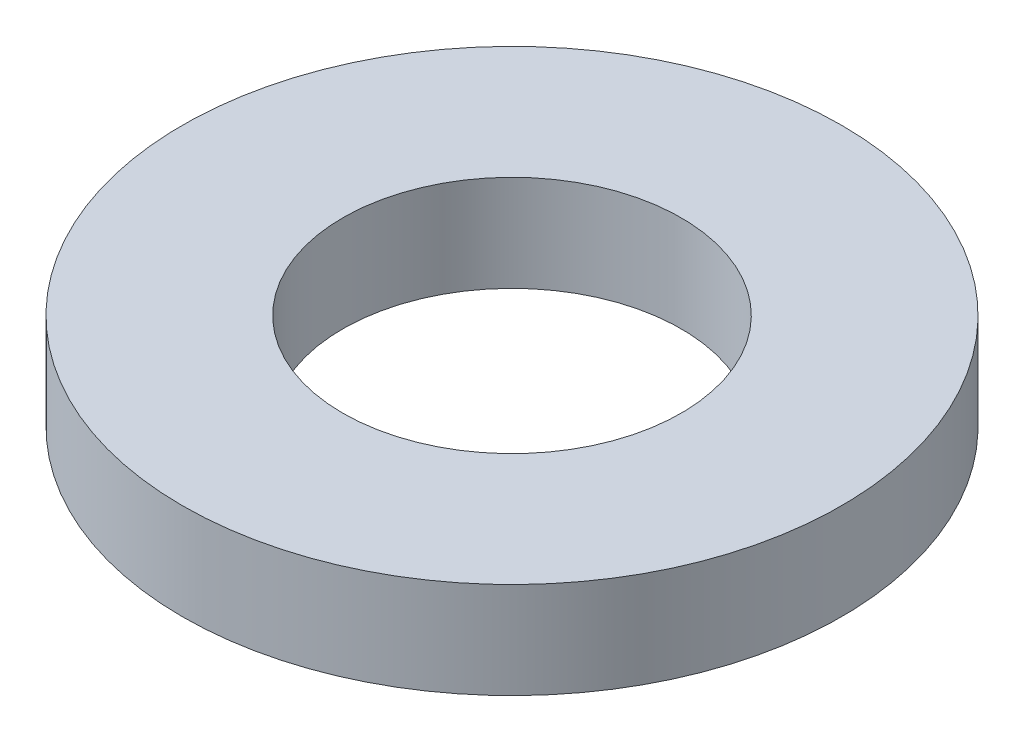
from build123d import *

# Parameters (mm, degrees)
SKETCH1_R           = 92.5
BOSS_EXTRUDE1_DEPTH = 27
SKETCH2_R           = 47.5
CUT_EXTRUDE1_DEPTH  = 134.57207792


with BuildPart() as part:
    # Sketch1 → Boss-Extrude1 (new body)
    with BuildSketch(Plane(origin=(0, 0, 0), x_dir=(1, 0, 0), z_dir=(0, 1, 0))):
        Circle(SKETCH1_R)
    extrude(amount=BOSS_EXTRUDE1_DEPTH)

    # Sketch2 → Cut-Extrude1 (cut, through all)
    with BuildSketch(Plane(origin=(0, 0, 0), x_dir=(1, 0, 0), z_dir=(0, 1, 0))):
        Circle(SKETCH2_R)
    extrude(amount=CUT_EXTRUDE1_DEPTH, mode=Mode.SUBTRACT)


solid = part.part
